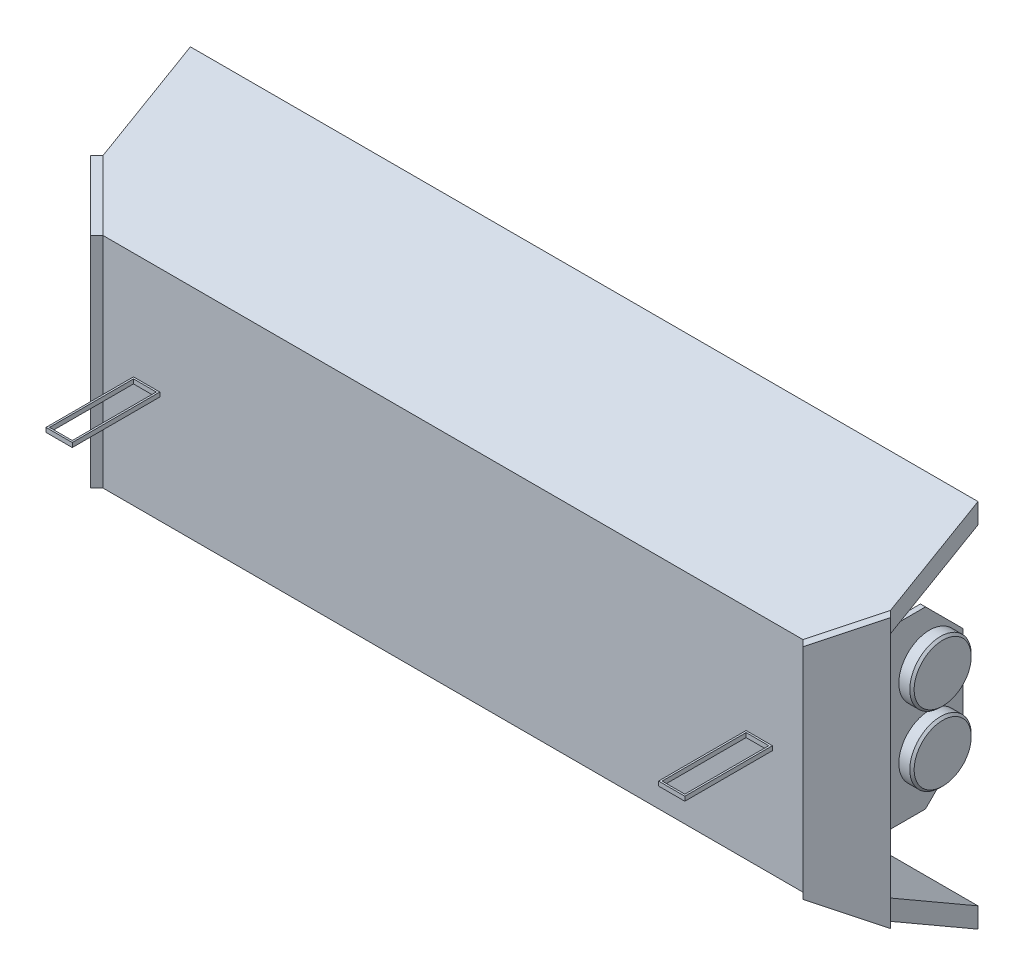
from build123d import *

# Parameters (mm, degrees)
BOSS_EXTRUDE1_DEPTH      = 0.45
CHAMFER1_SIZE            = 0.05
BOSS_EXTRUDE2_DEPTH      = 0.01
SKETCH3_W                = 0.005769739
SKETCH3_H                = 0.200017608
BOSS_EXTRUDE3_DEPTH      = 0.15
SKETCH4_W                = 0.016268309
SKETCH4_H                = 0.200017608
BOSS_EXTRUDE4_DEPTH      = 0.005
SKETCH5_W                = 0.03
SKETCH5_H                = 0.1
SKETCH5_W_2              = 0.026
SKETCH5_H_2              = 0.096
BOSS_EXTRUDE5_DEPTH      = 0.0025
BOSS_EXTRUDE6_REACH      = 2.924
SKETCH6_R                = 0.025
CUT_EXTRUDE1_DEPTH       = 1.929347517
SKETCH8_R                = 0.035094092
BOSS_EXTRUDE7_DEPTH      = 0.015
CHAMFER2_SIZE            = 0.0025
CHAMFER2_OF_MIRROR3_SIZE = 0.0025


with BuildPart() as part:
    # Sketch1 → Boss-Extrude1 (new, symmetric)
    with BuildSketch(Plane(origin=(0, 0, 0), x_dir=(0, 0, -1), z_dir=(1, 0, 0))):
        Polygon((-0.15, -0.125), (-0.15, 0.125), (0, 0.21160254), (0, 0.18850853), (-0.13, 0.113452995), (-0.13, -0.113452995), (0, -0.18850853), (0, -0.21160254), align=None)
    extrude(amount=BOSS_EXTRUDE1_DEPTH, both=True)

    # Chamfer1
    # the kernel refuses this chamfer: 0.05 mm, written as the material it takes off along each edge
    with BuildSketch(Plane(origin=(-0.45, -0.253584149, 0.15), x_dir=(0.9996219169112968, 0, 0.027495876610586285), z_dir=(0, 1, 0))) as chamfer1_piece_1:
        Polygon((CHAMFER1_SIZE * 0.999621916911, CHAMFER1_SIZE * 0.0274958766106), (-CHAMFER1_SIZE * 0.0274958766106, CHAMFER1_SIZE * 0.999621916911), (0, 0), align=None)
    extrude(amount=0.507168299, mode=Mode.SUBTRACT)
    with BuildSketch(Plane(origin=(0.45, -0.253584149, 0.15), x_dir=(-0.9996219169112968, 0, 0.027495876610586285), z_dir=(0, 1, 0))) as chamfer1_piece_2:
        Polygon((CHAMFER1_SIZE * 0.999621916911, -CHAMFER1_SIZE * 0.0274958766106), (-CHAMFER1_SIZE * 0.0274958766106, -CHAMFER1_SIZE * 0.999621916911), (0, 0), align=None)
    extrude(amount=0.507168299, mode=Mode.SUBTRACT)

    # Sketch2 → Boss-Extrude2 (add)
    with BuildSketch(Plane(origin=(0.275, 0, 0.275), x_dir=(0.7071067811865438, 0, -0.7071067811865513), z_dir=(0.7071067811865513, 0, 0.7071067811865438))):
        Polygon((0.176776695, 0.125), (0.247487373, 0.153867513), (0.247487373, -0.153867513), (0.176776695, -0.125), align=None)
    boss_extrude2 = extrude(amount=BOSS_EXTRUDE2_DEPTH)

    # Mirror1: Boss-Extrude2 across plane
    add(boss_extrude2.mirror(Plane(origin=(0, 0, 0), x_dir=(0, 0, 1), z_dir=(1, 0, 0))))

    # Sketch3 → Boss-Extrude3 (add)
    with BuildSketch(Plane(origin=(0, 0, 0.13), x_dir=(-1, 0, 0), z_dir=(0, 0, -1))):
        with Locations((-0.409763083, 0)):
            Rectangle(SKETCH3_W, SKETCH3_H)
    boss_extrude3 = extrude(amount=BOSS_EXTRUDE3_DEPTH)

    # Sketch4 → Boss-Extrude4 (add)
    with BuildSketch(Plane(origin=(0, 0, 0.13), x_dir=(-1, 0, 0), z_dir=(0, 0, -1))):
        with Locations((-0.398744059, 0)):
            Rectangle(SKETCH4_W, SKETCH4_H)
    boss_extrude4 = extrude(amount=BOSS_EXTRUDE4_DEPTH)

    # Sketch5 → Boss-Extrude5 (add, symmetric)
    # profile 1 of 2: a face of its own
    with BuildSketch(Plane(origin=(0, 0, 0), x_dir=(1, 0, 0), z_dir=(0, 1, 0))):
        with Locations((0.35, -0.2)):
            Rectangle(SKETCH5_W, SKETCH5_H)
        with Locations((0.35, -0.2)):
            Rectangle(SKETCH5_W_2, SKETCH5_H_2, mode=Mode.SUBTRACT)
    # profile 2 of 2: a face of its own
    with BuildSketch(Plane(origin=(0, 0, 0), x_dir=(1, 0, 0), z_dir=(0, 1, 0))):
        with Locations((-0.35, -0.2)):
            Rectangle(SKETCH5_W, SKETCH5_H)
        with Locations((-0.35, -0.2)):
            Rectangle(SKETCH5_W_2, SKETCH5_H_2, mode=Mode.SUBTRACT)
    extrude(amount=BOSS_EXTRUDE5_DEPTH, both=True)

    # Mirror2: Boss-Extrude3, Boss-Extrude4 across plane
    add(boss_extrude3.mirror(Plane(origin=(0, 0, 0), x_dir=(0, 0, 1), z_dir=(1, 0, 0))))
    add(boss_extrude4.mirror(Plane(origin=(0, 0, 0), x_dir=(0, 0, 1), z_dir=(1, 0, 0))))

    # Sketch6 → Boss-Extrude6 (add, up to next)
    with BuildSketch(Plane.ZY.offset(-0.406878213), mode=Mode.PRIVATE) as boss_extrude6_sk1:
        with Locations(Location((0.018001916, 0.039642936, 0), (0, 0, 180))):
            Circle(SKETCH6_R)
    boss_extrude6_tool1 = extrude(boss_extrude6_sk1.sketch, amount=BOSS_EXTRUDE6_REACH, mode=Mode.PRIVATE) - part.part
    # Sketch6 → Boss-Extrude6 (add, up to next)
    with BuildSketch(Plane.ZY.offset(-0.406878213), mode=Mode.PRIVATE) as boss_extrude6_sk2:
        with Locations(Location((0.018001916, -0.039642936, 0), (0, 0, 180))):
            Circle(SKETCH6_R)
    boss_extrude6_tool2 = extrude(boss_extrude6_sk2.sketch, amount=BOSS_EXTRUDE6_REACH, mode=Mode.PRIVATE) - part.part
    add(boss_extrude6_tool1.solids().sort_by_distance((0.406878, 0.039643, 0.018002))[0])
    add(boss_extrude6_tool2.solids().sort_by_distance((0.406878, -0.039643, 0.018002))[0])

    # Sketch7 → Cut-Extrude1 (cut, through all)
    with BuildSketch(Plane.ZY.offset(0.412647952)):
        Polygon((-0.02, 0.100008804), (0.02263059, 0.100008804), (-0.02, 0.057378214), align=None)
        Polygon((-0.02, -0.100008804), (0.02263059, -0.100008804), (-0.02, -0.057378214), align=None)
    extrude(amount=-CUT_EXTRUDE1_DEPTH, mode=Mode.SUBTRACT)

    # Sketch8 → Boss-Extrude7 (add)
    with BuildSketch(Plane(origin=(0.412647952, 0, 0), x_dir=(0, 0, -1), z_dir=(1, 0, 0))):
        with Locations(Location((-0.018001916, 0.039642936, 0), (0, 0, 180))):
            Circle(SKETCH8_R)
        with Locations(Location((-0.018001916, -0.039642936, 0), (0, 0, 180))):
            Circle(SKETCH8_R)
    boss_extrude7 = extrude(amount=BOSS_EXTRUDE7_DEPTH)

    # Chamfer2
    chamfer2_edges = [part.edges().sort_by_distance(p)[0] for p in [
        (0.427647952, 0.039642936, -0.017092176),
        (0.427647952, -0.039642936, -0.017092176),
    ]]
    chamfer(chamfer2_edges, length=CHAMFER2_SIZE)

    # Mirror3: Boss-Extrude7 across plane
    add(boss_extrude7.mirror(Plane(origin=(0, 0, 0), x_dir=(0, 0, 1), z_dir=(1, 0, 0))))

    # Chamfer2 of Mirror3
    chamfer2_of_mirror3_edges = [part.edges().sort_by_distance(p)[0] for p in [
        (-0.427647952, 0.039642936, -0.017092176),
        (-0.427647952, -0.039642936, -0.017092176),
    ]]
    chamfer(chamfer2_of_mirror3_edges, length=CHAMFER2_OF_MIRROR3_SIZE)


solid = part.part
